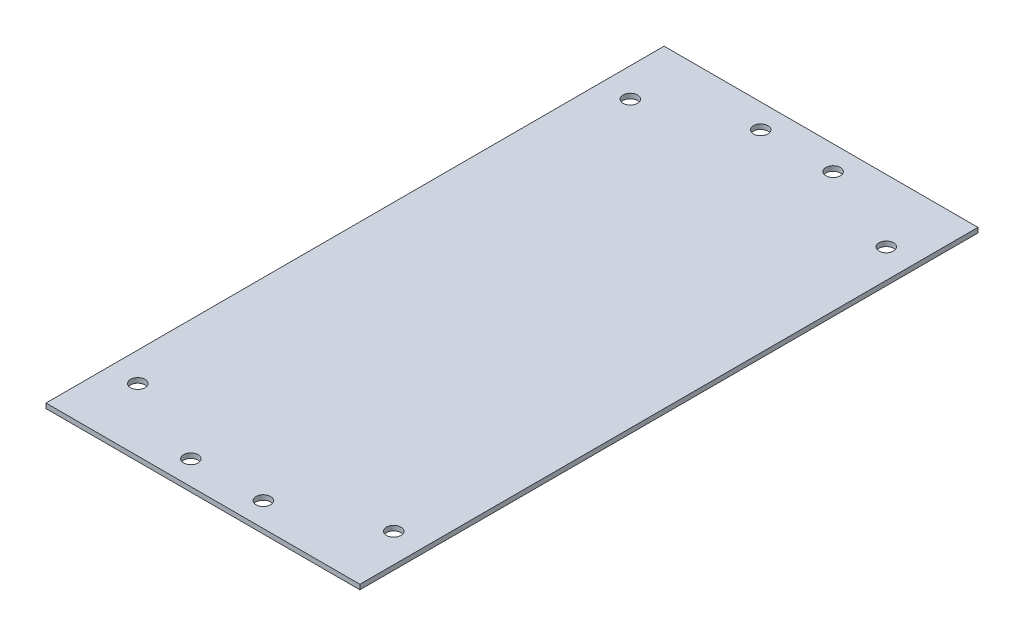
from build123d import *

# Parameters (mm, degrees)
SKETCH_1_W          = 65
SKETCH_1_H          = 128
SKETCH_1_R          = 1.5
EXTRUDE_1_DEPTH     = 1
SKETCH_2_R          = 1.5
CUT_EXTRUDE_1_DEPTH = 106.163495705


with BuildPart() as part:
    # Эскиз1 → Бобышка-Вытянуть1 (new body)
    with BuildSketch(Plane(origin=(0, 0, 0), x_dir=(1, 0, 0), z_dir=(0, 1, 0))):
        with Locations((-41.85845893, -10.35845893)):
            Rectangle(SKETCH_1_W, SKETCH_1_H)
        with Locations((-68.35845893, 40.64154107)):
            Circle(SKETCH_1_R, mode=Mode.SUBTRACT)
        with Locations((-15.35845893, 40.64154107)):
            Circle(SKETCH_1_R, mode=Mode.SUBTRACT)
        with Locations((-15.35845893, -61.35845893)):
            Circle(SKETCH_1_R, mode=Mode.SUBTRACT)
        with Locations((-68.35845893, -61.35845893)):
            Circle(SKETCH_1_R, mode=Mode.SUBTRACT)
    extrude(amount=EXTRUDE_1_DEPTH)

    # Эскиз2 → Вырез-Вытянуть1 (cut, through all)
    with BuildSketch(Plane(origin=(0, 1, 0), x_dir=(1, 0, 0), z_dir=(0, 1, 0))):
        with Locations((-49.35845893, 48.64154107)):
            Circle(SKETCH_2_R)
        with Locations((-34.35845893, 48.64154107)):
            Circle(SKETCH_2_R)
        with Locations((-34.35845893, -69.35845893)):
            Circle(SKETCH_2_R)
        with Locations((-49.35845893, -69.35845893)):
            Circle(SKETCH_2_R)
    extrude(amount=-CUT_EXTRUDE_1_DEPTH, mode=Mode.SUBTRACT)


solid = part.part
